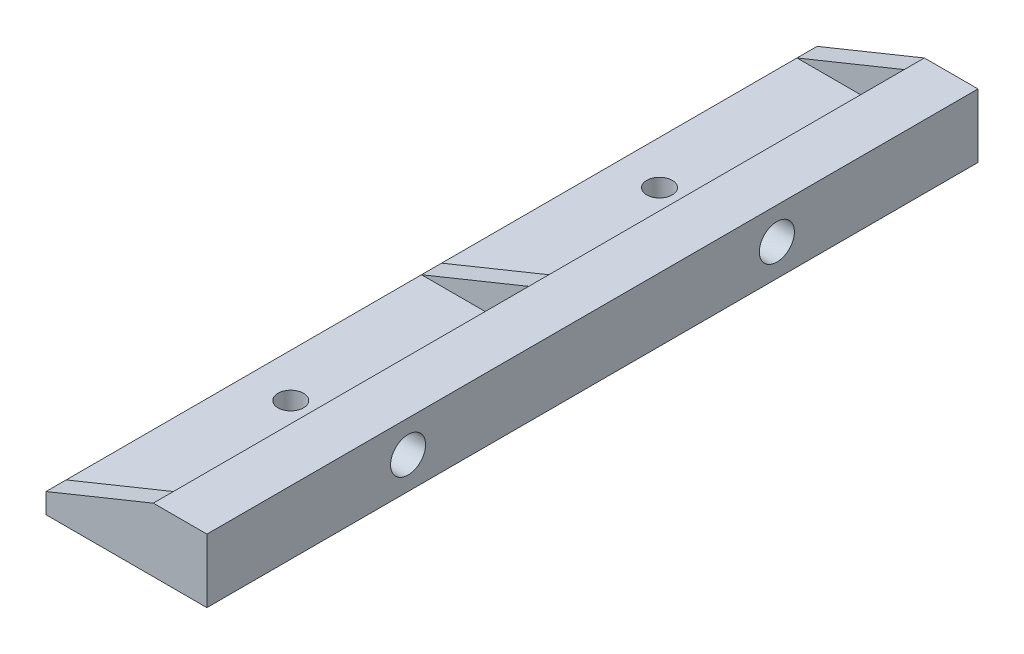
from build123d import *

# Parameters (mm, degrees)
BOSS_EXTRUDE1_DEPTH   = 115
RIB3_REACH            = 65.028
SKETCH4_WALL_W        = 145.325459352
SKETCH4_WALL_H        = 3
RIB4_START            = -3
RIB4_DEPTH            = 3
F_6_CLEARANCE_HOLE1_D = 3.7973
SKETCH6_R             = 2.3495
CUT_EXTRUDE1_DEPTH    = 7
SKETCH12_R            = 2.6162
CUT_EXTRUDE2_DEPTH    = 6.35


# Read off the part's stored shape, not the designer's step: Rib4
with BuildPart() as part:
    # Sketch1 → Boss-Extrude1 (new body)
    with BuildSketch(Plane.XY):
        with BuildLine():
            Line((0, 0), (0, 9.5))
            Line((0, 9.5), (-8, 9.5))
            Line((-8, 9.5), (-8, 6))
            ThreePointArc((-8, 6), (-8.878679656, 3.878679656), (-11, 3))
            Line((-11, 3), (-24, 3))
            Line((-24, 3), (-24, 0))
            Line((-24, 0), (0, 0))
        make_face()
    extrude(amount=BOSS_EXTRUDE1_DEPTH)

    # Sketch4 wall → Rib3 (add, up to next)
    with BuildSketch(Plane(origin=(-16, 6.25, 57.5), x_dir=(-0.926466577122, -0.376377046956, 0), z_dir=(-0.376377046956, 0.926466577122, 0)), mode=Mode.PRIVATE) as rib3_sk1:
        Rectangle(SKETCH4_WALL_W, SKETCH4_WALL_H)
    rib3_tool1 = extrude(rib3_sk1.sketch, amount=-RIB3_REACH, mode=Mode.PRIVATE) - part.part
    add(rib3_tool1.solids().sort_by_distance((-16, 6.25, 57.5))[0])

    # Rib4 outline → Rib4 (add)
    with BuildSketch(Plane(origin=(0, 0, 0), x_dir=(-1, 0, 0), z_dir=(0, 0, -1)).offset(RIB4_START)):
        with BuildLine():
            Line((24, 3), (8, 9.5))
            Line((8, 9.5), (8, 6))
            ThreePointArc((8, 6), (8.878679656, 3.878679656), (11, 3))
            Line((11, 3), (24, 3))
        make_face()
    rib4 = extrude(amount=RIB4_DEPTH)

    # Mirror1: Rib4 across plane
    add(rib4.mirror(Plane(origin=(0, 0, 57.5), x_dir=(1, 0, 0), z_dir=(0, 0, -1))))

    # #6 Clearance Hole1 (through all)
    with Locations(Plane(origin=(0, 0, 0), x_dir=(-1, 0, 0), z_dir=(0, -1, 0))):
        with Locations((17.5, -30), (17.5, -85)):
            Hole(F_6_CLEARANCE_HOLE1_D / 2)

    # Sketch6 → Cut-Extrude1 (cut)
    with BuildSketch(Plane(origin=(0, 0, 0), x_dir=(0, 0, -1), z_dir=(1, 0, 0))):
        with Locations((-85, 4.75)):
            Circle(SKETCH6_R)
        with Locations((-30, 4.75)):
            Circle(SKETCH6_R)
    extrude(amount=-CUT_EXTRUDE1_DEPTH, mode=Mode.SUBTRACT)

    # Sketch12 → Cut-Extrude2 (cut)
    with BuildSketch(Plane(origin=(0, 0, 0), x_dir=(0, 0, -1), z_dir=(1, 0, 0))):
        with Locations((-85, 4.75)):
            Circle(SKETCH12_R)
        with Locations((-30, 4.75)):
            Circle(SKETCH12_R)
    extrude(amount=-CUT_EXTRUDE2_DEPTH, mode=Mode.SUBTRACT)


solid = part.part
